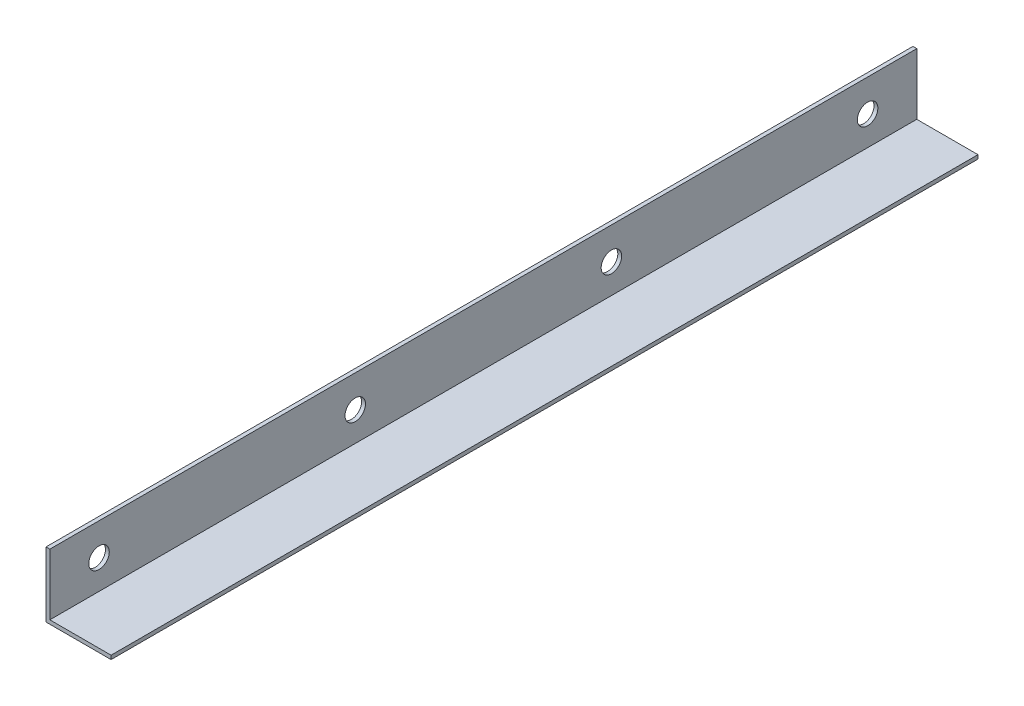
from build123d import *

# Parameters (mm, degrees)
SALIENTE_EXTRUIR1_DEPTH = 338.4
CROQUIS2_R              = 4
CORTAR_EXTRUIR1_DEPTH   = 2


with BuildPart() as part:
    # Croquis1 → Saliente-Extruir1 (new body)
    with BuildSketch(Plane.XY):
        Polygon((0, 0), (0, 25.4), (1.5, 25.4), (1.5, 1.5), (25.4, 1.5), (25.4, 0), align=None)
    extrude(amount=SALIENTE_EXTRUIR1_DEPTH)

    # Croquis2 → Cortar-Extruir1 (cut)
    with BuildSketch(Plane(origin=(1.5, 0, 0), x_dir=(0, 0, -1), z_dir=(1, 0, 0))):
        with Locations((-219.2, 12.9)):
            Circle(CROQUIS2_R)
        with Locations((-119.2, 12.9)):
            Circle(CROQUIS2_R)
        with Locations((-19.2, 12.9)):
            Circle(CROQUIS2_R)
        with Locations((-319.2, 12.9)):
            Circle(CROQUIS2_R)
    extrude(amount=-CORTAR_EXTRUIR1_DEPTH, mode=Mode.SUBTRACT)


solid = part.part
